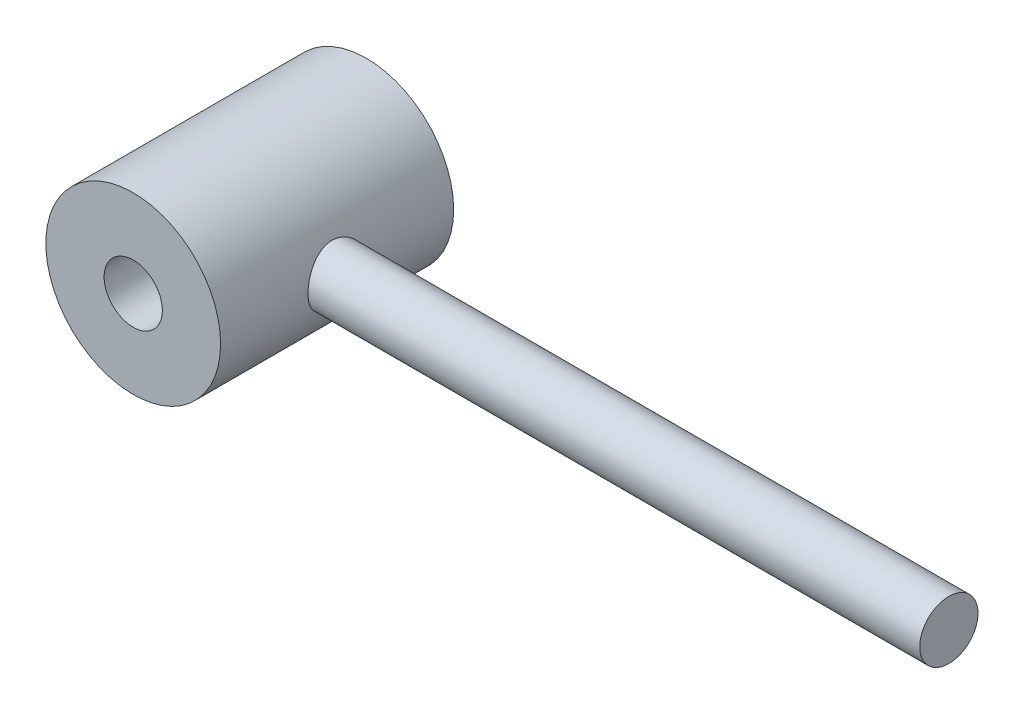
from build123d import *

# Parameters (mm, degrees)
SKETCH1_R                = 6.35
BOSS_EXTRUDE1_DEPTH      = 152.4
BOSS_EXTRUDE2_DEPTH      = 25.4
BOSS_EXTRUDE2_DEPTH_BACK = 25.4
SKETCH2_R                = 19.05
CUT_EXTRUDE1_REACH       = 163.769
SKETCH3_R                = 6.35


with BuildPart() as part:
    # Sketch1 → Boss-Extrude1 (new body)
    with BuildSketch(Plane(origin=(0, 0, 0), x_dir=(0, 0, -1), z_dir=(1, 0, 0))):
        Circle(SKETCH1_R)
    extrude(amount=BOSS_EXTRUDE1_DEPTH)

    # Sketch2 → Boss-Extrude2 (add, two sides: drawn at the far end of the back side and taken through both)
    with BuildSketch(Plane.XY.offset(-BOSS_EXTRUDE2_DEPTH_BACK)):
        Circle(SKETCH2_R)
    extrude(amount=BOSS_EXTRUDE2_DEPTH + BOSS_EXTRUDE2_DEPTH_BACK)

    # Sketch3 → Cut-Extrude1 (cut, up to next)
    with BuildSketch(Plane.XY.offset(25.4), mode=Mode.PRIVATE) as cut_extrude1_sk1:
        Circle(SKETCH3_R)
    cut_extrude1_tool1 = extrude(cut_extrude1_sk1.sketch, amount=-CUT_EXTRUDE1_REACH, mode=Mode.PRIVATE) & part.part
    add(cut_extrude1_tool1.solids().sort_by_distance((0, 0, 25.4))[0], mode=Mode.SUBTRACT)


solid = part.part
